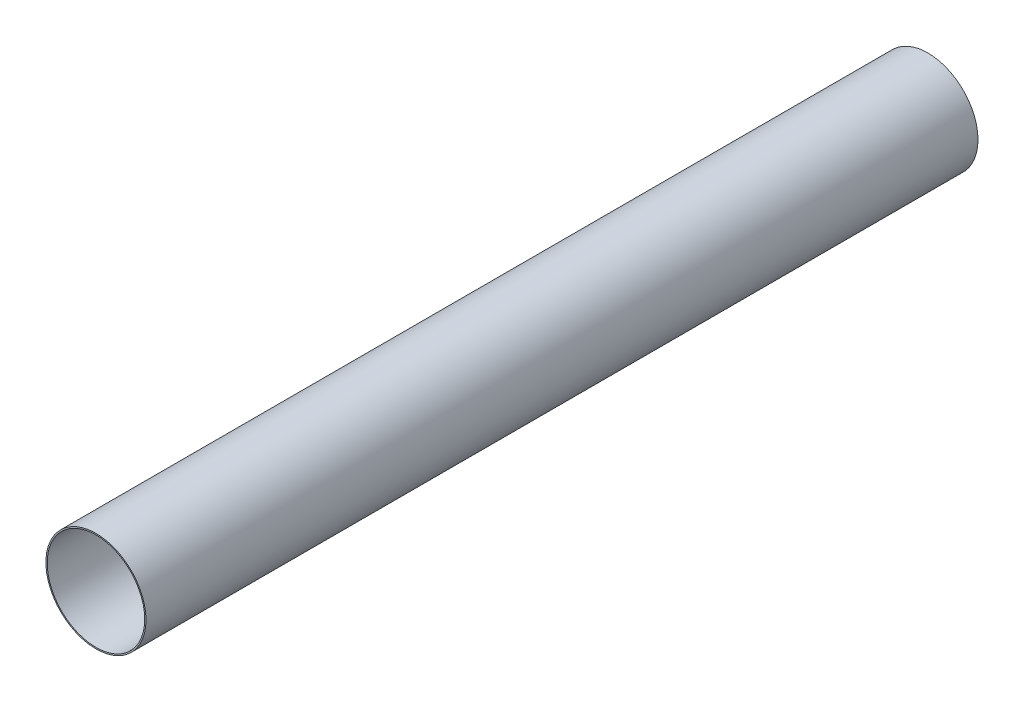
from build123d import *

# Parameters (mm, degrees)
SKETCH1_R           = 78.2
SKETCH1_R_2         = 76.2
BOSS_EXTRUDE1_DEPTH = 1300


with BuildPart() as part:
    # Sketch1 → Boss-Extrude1 (new body)
    with BuildSketch(Plane.XY):
        Circle(SKETCH1_R)
        Circle(SKETCH1_R_2, mode=Mode.SUBTRACT)
    extrude(amount=BOSS_EXTRUDE1_DEPTH)


solid = part.part
